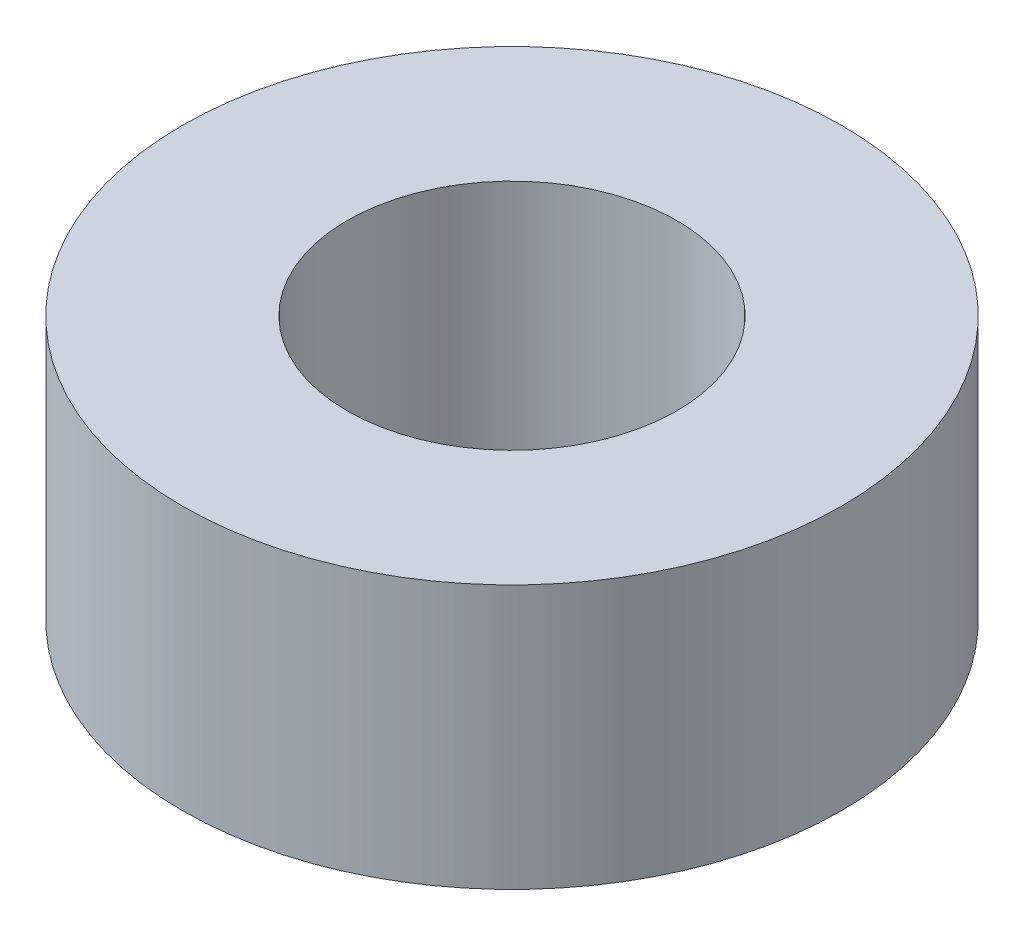
from build123d import *

# Parameters (mm, degrees)
SKETCH1_R           = 30
BOSS_EXTRUDE1_DEPTH = 24
SKETCH2_R           = 15
CUT_EXTRUDE1_DEPTH  = 49.744230428


with BuildPart() as part:
    # Sketch1 → Boss-Extrude1 (new body)
    with BuildSketch(Plane(origin=(0, 0, 0), x_dir=(1, 0, 0), z_dir=(0, 1, 0))):
        Circle(SKETCH1_R)
    extrude(amount=BOSS_EXTRUDE1_DEPTH)

    # Sketch2 → Cut-Extrude1 (cut, through all)
    with BuildSketch(Plane(origin=(0, 0, 0), x_dir=(1, 0, 0), z_dir=(0, 1, 0))):
        Circle(SKETCH2_R)
    extrude(amount=CUT_EXTRUDE1_DEPTH, mode=Mode.SUBTRACT)


solid = part.part
